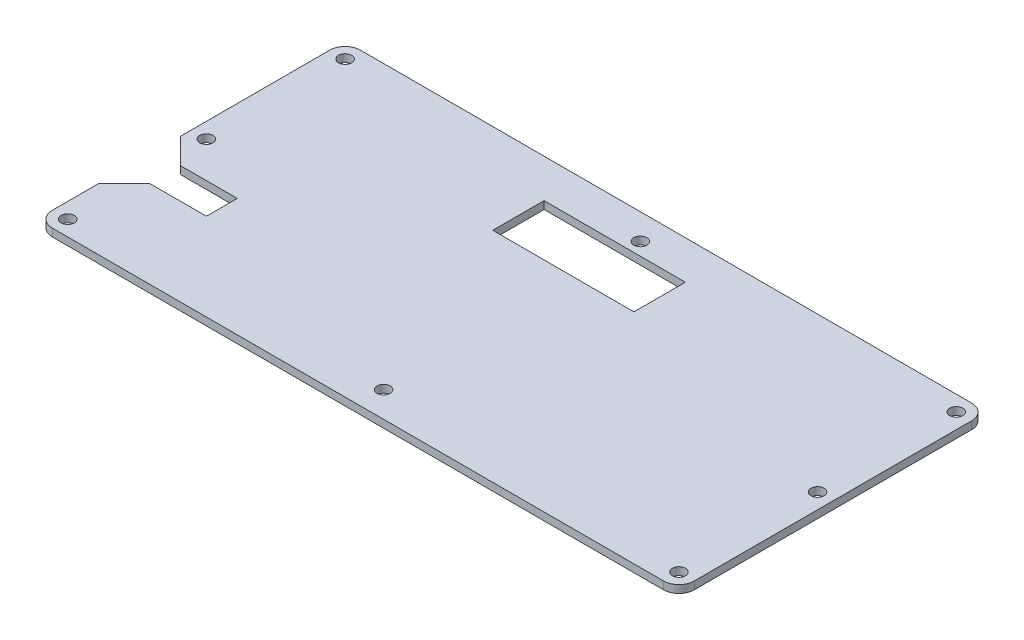
from build123d import *

# Parameters (mm, degrees)
SKETCH_1_R      = 2.55
SKETCH_1_W      = 55
SKETCH_1_H      = 20
EXTRUDE_1_DEPTH = 3


with BuildPart() as part:
    # 草图1 → 凸台-拉伸1 (new body)
    with BuildSketch(Plane(origin=(0, 0, 0), x_dir=(1, 0, 0), z_dir=(0, 1, 0))):
        with BuildLine():
            Line((16.20771131, 68.233643966), (16.20771131, 126.233643966))
            ThreePointArc((16.20771131, 126.233643966), (17.965070623, 130.476284653), (22.20771131, 132.233643966))
            Line((22.20771131, 132.233643966), (260.20771131, 132.233643966))
            ThreePointArc((260.20771131, 132.233643966), (264.450351998, 130.476284653), (266.20771131, 126.233643966))
            Line((266.20771131, 126.233643966), (266.20771131, 18.233643966))
            ThreePointArc((266.20771131, 18.233643966), (264.450351998, 13.991003279), (260.20771131, 12.233643966))
            Line((260.20771131, 12.233643966), (22.20771131, 12.233643966))
            ThreePointArc((22.20771131, 12.233643966), (17.965070623, 13.991003279), (16.20771131, 18.233643966))
            Line((16.20771131, 18.233643966), (16.20771131, 36.233643966))
            Line((16.20771131, 36.233643966), (26.20771131, 46.233643966))
            Line((26.20771131, 46.233643966), (48.20771131, 46.233643966))
            Line((48.20771131, 46.233643966), (48.20771131, 58.233643966))
            Line((48.20771131, 58.233643966), (26.20771131, 58.233643966))
            Line((26.20771131, 58.233643966), (16.20771131, 68.233643966))
        make_face()
        with Locations((22.20771131, 126.233643966)):
            Circle(SKETCH_1_R, mode=Mode.SUBTRACT)
        with Locations((260.20771131, 126.233643966)):
            Circle(SKETCH_1_R, mode=Mode.SUBTRACT)
        with Locations((141.20771131, 122.233643966)):
            Circle(SKETCH_1_R, mode=Mode.SUBTRACT)
        with Locations((22.20771131, 18.233643966)):
            Circle(SKETCH_1_R, mode=Mode.SUBTRACT)
        with Locations((260.20771131, 18.233643966)):
            Circle(SKETCH_1_R, mode=Mode.SUBTRACT)
        with Locations((141.20771131, 22.233643966)):
            Circle(SKETCH_1_R, mode=Mode.SUBTRACT)
        with Locations((260.20771131, 72.233643966)):
            Circle(SKETCH_1_R, mode=Mode.SUBTRACT)
        with Locations((22.20771131, 72.233643966)):
            Circle(SKETCH_1_R, mode=Mode.SUBTRACT)
        with Locations((136.20771131, 107.233643966)):
            Rectangle(SKETCH_1_W, SKETCH_1_H, mode=Mode.SUBTRACT)
    extrude(amount=EXTRUDE_1_DEPTH)


solid = part.part
